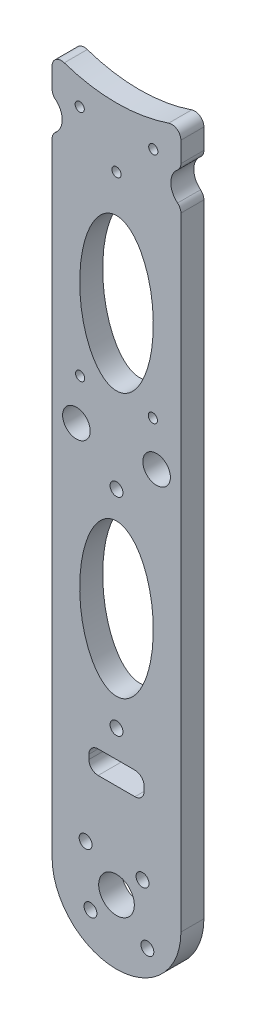
from build123d import *

# Parameters (mm, degrees)
SKETCH1_R           = 1
SKETCH1_R_2         = 1.4
SKETCH1_R_3         = 3
SKETCH1_RX          = 16.5
SKETCH1_RY          = 8
BOSS_EXTRUDE1_DEPTH = 5
CUT_EXTRUDE1_REACH  = 153.803
SKETCH2_R           = 3.875


with BuildPart() as part:
    # Sketch1 → Boss-Extrude1 (new body)
    with BuildSketch(Plane.XY):
        with BuildLine():
            Line((-14, 0), (-14, 135.347392982))
            ThreePointArc((-14, 135.347392982), (-13.809166738, 136.199986504), (-13.273084285, 136.889876824))
            ThreePointArc((-13.273084285, 136.889876824), (-11.805402668, 140.00423401), (-13.273084285, 143.118591196))
            ThreePointArc((-13.273084285, 143.118591196), (-13.809166738, 143.808481515), (-14, 144.661075038))
            Line((-14, 144.661075038), (-14, 149.07320666))
            ThreePointArc((-14, 149.07320666), (-13.162476387, 150.700673602), (-11.351351351, 150.965098552))
            ThreePointArc((-11.351351351, 150.965098552), (0, 149.07320666), (11.351351351, 150.965098552))
            ThreePointArc((11.351351351, 150.965098552), (13.162476387, 150.700673602), (14, 149.07320666))
            Line((14, 149.07320666), (14, 144.661075038))
            ThreePointArc((14, 144.661075038), (13.809166738, 143.808481515), (13.273084285, 143.118591196))
            ThreePointArc((13.273084285, 143.118591196), (11.805402668, 140.00423401), (13.273084285, 136.889876824))
            ThreePointArc((13.273084285, 136.889876824), (13.809166738, 136.199986504), (14, 135.347392982))
            Line((14, 135.347392982), (14, 0))
            ThreePointArc((14, 0), (0, -14), (-14, 0))
        make_face()
        with Locations((-8, 144.371191598)):
            Circle(SKETCH1_R, mode=Mode.SUBTRACT)
        with Locations((6.717514421, -6.717514421)):
            Circle(SKETCH1_R_2, mode=Mode.SUBTRACT)
        with Locations((-5.656854249, -5.656854249)):
            Circle(SKETCH1_R_2, mode=Mode.SUBTRACT)
        with Locations((5.656854249, 5.656854249)):
            Circle(SKETCH1_R_2, mode=Mode.SUBTRACT)
        with Locations((-6.717514421, 6.717514421)):
            Circle(SKETCH1_R_2, mode=Mode.SUBTRACT)
        with Locations((8, 144.371191598)):
            Circle(SKETCH1_R, mode=Mode.SUBTRACT)
        with Locations((0, 136.07320666)):
            Circle(SKETCH1_R, mode=Mode.SUBTRACT)
        with Locations((7.903282752, 93.738271437)):
            Circle(SKETCH1_R, mode=Mode.SUBTRACT)
        with Locations((0, 31.383897204)):
            Circle(SKETCH1_R_2, mode=Mode.SUBTRACT)
        with Locations((0, 76.383897204)):
            Circle(SKETCH1_R_2, mode=Mode.SUBTRACT)
        with Locations((8.715574275, 84.453736851)):
            Circle(SKETCH1_R_3, mode=Mode.SUBTRACT)
        with Locations((-7.903282752, 93.738271437)):
            Circle(SKETCH1_R, mode=Mode.SUBTRACT)
        with Locations((-8.715574275, 84.453736851)):
            Circle(SKETCH1_R_3, mode=Mode.SUBTRACT)
        with Locations(Location((0, 53.883897204), (0, 0, 90))):
            Ellipse(SKETCH1_RX, SKETCH1_RY, mode=Mode.SUBTRACT)
        with Locations(Location((0, 111.383897204), (0, 0, 90))):
            Ellipse(SKETCH1_RX, SKETCH1_RY, mode=Mode.SUBTRACT)
        with BuildLine():
            Line((-4, 20.483897204), (4, 20.483897204))
            ThreePointArc((4, 20.483897204), (5.414213562, 21.069683642), (6, 22.483897204))
            Line((6, 22.483897204), (6, 23.483897204))
            ThreePointArc((6, 23.483897204), (5.414213562, 24.898110767), (4, 25.483897204))
            Line((4, 25.483897204), (-4, 25.483897204))
            ThreePointArc((-4, 25.483897204), (-5.414213562, 24.898110767), (-6, 23.483897204))
            Line((-6, 23.483897204), (-6, 22.483897204))
            ThreePointArc((-6, 22.483897204), (-5.414213562, 21.069683642), (-4, 20.483897204))
        make_face(mode=Mode.SUBTRACT)
    extrude(amount=BOSS_EXTRUDE1_DEPTH)

    # Sketch2 → Cut-Extrude1 (cut, up to next)
    with BuildSketch(Plane.XY.offset(5), mode=Mode.PRIVATE) as cut_extrude1_sk1:
        Circle(SKETCH2_R)
    cut_extrude1_tool1 = extrude(cut_extrude1_sk1.sketch, amount=-CUT_EXTRUDE1_REACH, mode=Mode.PRIVATE) & part.part
    add(cut_extrude1_tool1.solids().sort_by_distance((0, 0, 5))[0], mode=Mode.SUBTRACT)


solid = part.part
